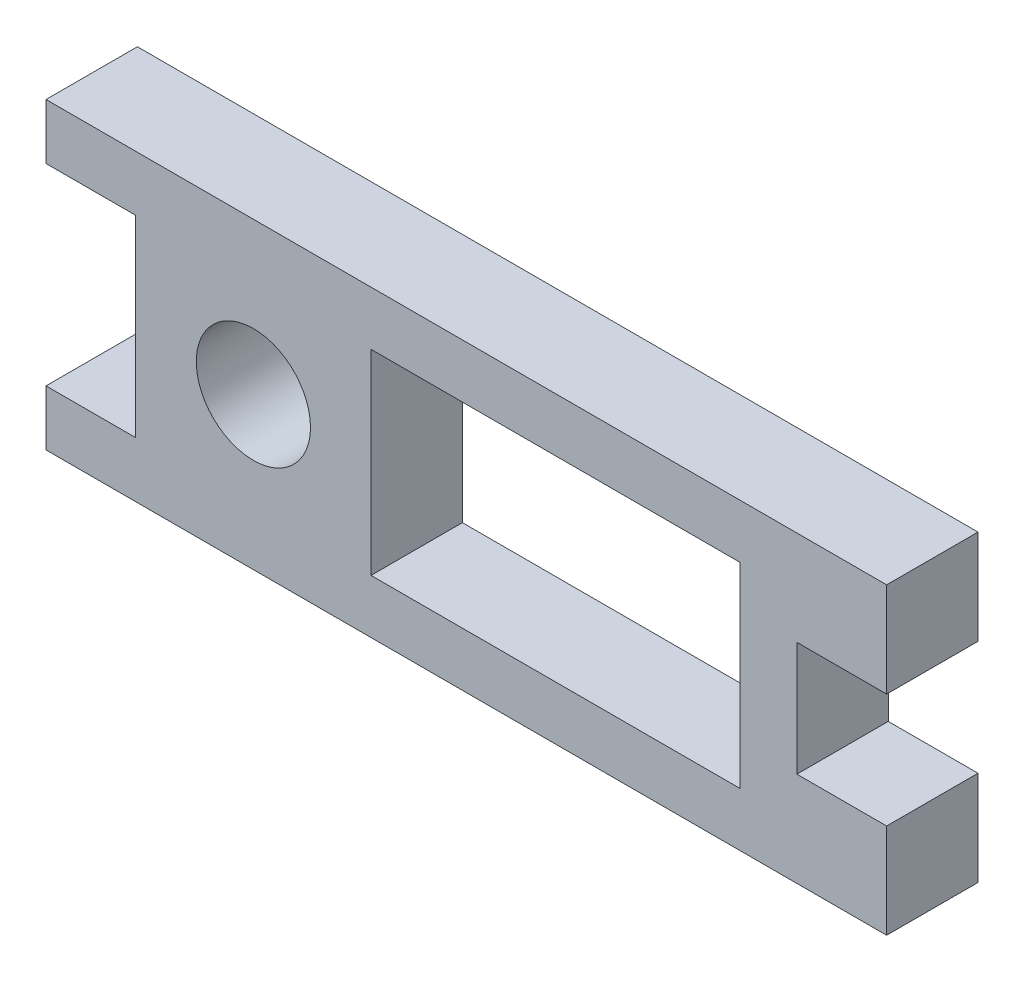
from build123d import *

# Parameters (mm, degrees)
SKETCH1_R           = 3.5
SKETCH1_W           = 22.6
SKETCH1_H           = 12
BOSS_EXTRUDE1_DEPTH = 5.6


with BuildPart() as part:
    # Sketch1 → Boss-Extrude1 (new body)
    with BuildSketch(Plane.XY):
        Polygon((704.254416841, 403.699543709), (704.254416841, 391.899543709), (698.754416841, 391.899543709), (698.754416841, 388.499543709), (750.274416841, 388.499543709), (750.274416841, 394.299543709), (744.774416841, 394.299543709), (744.774416841, 401.299543709), (750.274416841, 401.299543709), (750.274416841, 407.099543709), (698.754416841, 407.099543709), (698.754416841, 403.699543709), align=None)
        with Locations((711.464416841, 397.799543709)):
            Circle(SKETCH1_R, mode=Mode.SUBTRACT)
        with Locations((729.974416841, 397.799543709)):
            Rectangle(SKETCH1_W, SKETCH1_H, mode=Mode.SUBTRACT)
    extrude(amount=BOSS_EXTRUDE1_DEPTH)


solid = part.part
